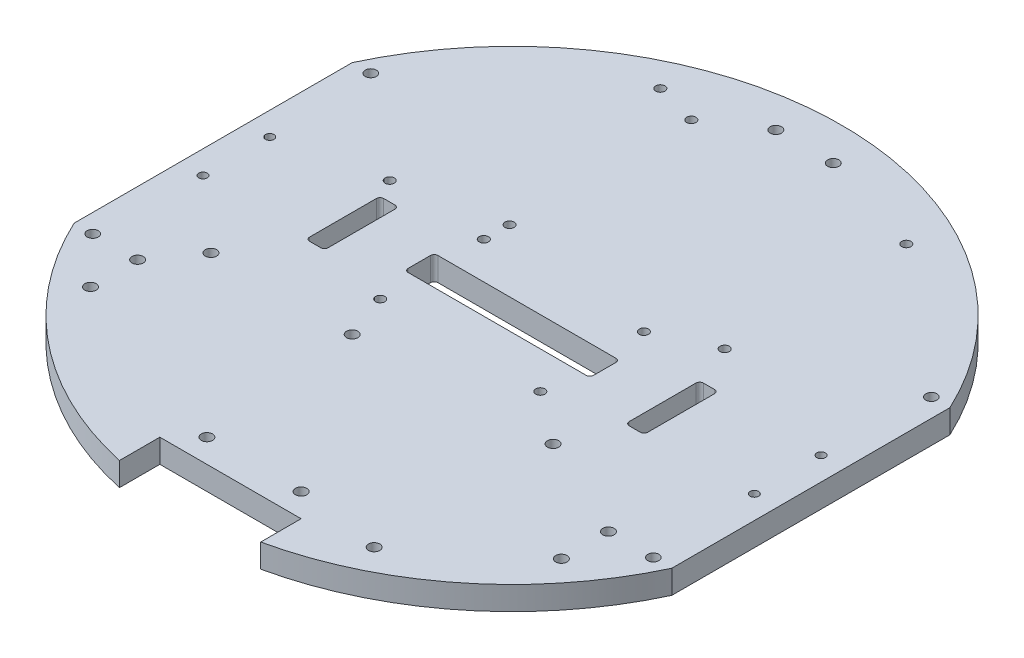
from build123d import *

# Parameters (mm, degrees)
MAIN_BODY_DEPTH             = 6.35
RASPBERRY_PI_REACH          = 122.169
SKETCH2_R                   = 1.25
MOTOR_MOUNTS_REACH          = 122.169
SKETCH3_R                   = 1.143
CASTER_REACH                = 122.169
SKETCH4_R                   = 1.524
SKETCH5_R                   = 1.524
GRABBER_MOUNT_DEPTH         = 121.168600308
SKETCH6_R                   = 1.524
FRONT_IR_DEPTH              = 121.168600308
SKETCH8_R                   = 1.524
SIDE_IR_DEPTH               = 121.168600308
SKETCH9_R                   = 1.524
PIXY_MOUNT_DEPTH            = 121.168600308
SKETCH10_W                  = 38.1
SKETCH10_H                  = 25.908
GRABBER_SLOT_DEPTH          = 121.168600308
SKETCH11_W                  = 5
SKETCH11_H                  = 20
SKETCH11_W_2                = 50
SKETCH11_H_2                = 8
WIRE_SLOTS_DEPTH            = 121.168600308
SKETCH13_R                  = 1.5
F_2ND_LEVEL_STANDOFFS_DEPTH = 121.168600308
FILLET1_R                   = 1
SKETCH14_R                  = 1.25
ENCODER_PERFBOARD_DEPTH     = 10
SKETCH15_R                  = 1.25
CUT_EXTRUDE2_DEPTH          = 10


with BuildPart() as part:
    # Sketch1 → Main Body (new body)
    with BuildSketch(Plane(origin=(0, 0, 0), x_dir=(1, 0, 0), z_dir=(0, 1, 0))):
        with BuildLine():
            Line((-80.603721998, 37.5), (-80.603721998, -37.5))
            ThreePointArc((-80.603721998, -37.5), (0, -88.9), (80.603721998, -37.5))
            Line((80.603721998, -37.5), (80.603721998, 37.5))
            ThreePointArc((80.603721998, 37.5), (0, 88.9), (-80.603721998, 37.5))
        make_face()
    extrude(amount=MAIN_BODY_DEPTH)

    # Sketch2 → Raspberry Pi (cut, up to next)
    with BuildSketch(Plane(origin=(0, 6.35, 0), x_dir=(1, 0, 0), z_dir=(0, 1, 0)), mode=Mode.PRIVATE) as raspberry_pi_sk1:
        with Locations((36.5, 69.85)):
            Circle(SKETCH2_R)
    raspberry_pi_tool1 = extrude(raspberry_pi_sk1.sketch, amount=-RASPBERRY_PI_REACH, mode=Mode.PRIVATE) & part.part
    # Sketch2 → Raspberry Pi (cut, up to next)
    with BuildSketch(Plane(origin=(0, 6.35, 0), x_dir=(1, 0, 0), z_dir=(0, 1, 0)), mode=Mode.PRIVATE) as raspberry_pi_sk2:
        with Locations((36.5, 20.85)):
            Circle(SKETCH2_R)
    raspberry_pi_tool2 = extrude(raspberry_pi_sk2.sketch, amount=-RASPBERRY_PI_REACH, mode=Mode.PRIVATE) & part.part
    # Sketch2 → Raspberry Pi (cut, up to next)
    with BuildSketch(Plane(origin=(0, 6.35, 0), x_dir=(1, 0, 0), z_dir=(0, 1, 0)), mode=Mode.PRIVATE) as raspberry_pi_sk3:
        with Locations((-21.5, 20.85)):
            Circle(SKETCH2_R)
    raspberry_pi_tool3 = extrude(raspberry_pi_sk3.sketch, amount=-RASPBERRY_PI_REACH, mode=Mode.PRIVATE) & part.part
    # Sketch2 → Raspberry Pi (cut, up to next)
    with BuildSketch(Plane(origin=(0, 6.35, 0), x_dir=(1, 0, 0), z_dir=(0, 1, 0)), mode=Mode.PRIVATE) as raspberry_pi_sk4:
        with Locations((-21.5, 69.85)):
            Circle(SKETCH2_R)
    raspberry_pi_tool4 = extrude(raspberry_pi_sk4.sketch, amount=-RASPBERRY_PI_REACH, mode=Mode.PRIVATE) & part.part
    add(raspberry_pi_tool1.solids().sort_by_distance((36.5, 6.35, -69.85))[0], mode=Mode.SUBTRACT)
    add(raspberry_pi_tool2.solids().sort_by_distance((36.5, 6.35, -20.85))[0], mode=Mode.SUBTRACT)
    add(raspberry_pi_tool3.solids().sort_by_distance((-21.5, 6.35, -20.85))[0], mode=Mode.SUBTRACT)
    add(raspberry_pi_tool4.solids().sort_by_distance((-21.5, 6.35, -69.85))[0], mode=Mode.SUBTRACT)

    # Sketch3 → Motor Mounts (cut, up to next)
    with BuildSketch(Plane(origin=(0, 6.35, 0), x_dir=(1, 0, 0), z_dir=(0, 1, 0)), mode=Mode.PRIVATE) as motor_mounts_sk1:
        with Locations((-74.353721998, 9)):
            Circle(SKETCH3_R)
    motor_mounts_tool1 = extrude(motor_mounts_sk1.sketch, amount=-MOTOR_MOUNTS_REACH, mode=Mode.PRIVATE) & part.part
    # Sketch3 → Motor Mounts (cut, up to next)
    with BuildSketch(Plane(origin=(0, 6.35, 0), x_dir=(1, 0, 0), z_dir=(0, 1, 0)), mode=Mode.PRIVATE) as motor_mounts_sk2:
        with Locations((-74.353721998, -9)):
            Circle(SKETCH3_R)
    motor_mounts_tool2 = extrude(motor_mounts_sk2.sketch, amount=-MOTOR_MOUNTS_REACH, mode=Mode.PRIVATE) & part.part
    # Sketch3 → Motor Mounts (cut, up to next)
    with BuildSketch(Plane(origin=(0, 6.35, 0), x_dir=(1, 0, 0), z_dir=(0, 1, 0)), mode=Mode.PRIVATE) as motor_mounts_sk3:
        with Locations((74.353721998, 9)):
            Circle(SKETCH3_R)
    motor_mounts_tool3 = extrude(motor_mounts_sk3.sketch, amount=-MOTOR_MOUNTS_REACH, mode=Mode.PRIVATE) & part.part
    # Sketch3 → Motor Mounts (cut, up to next)
    with BuildSketch(Plane(origin=(0, 6.35, 0), x_dir=(1, 0, 0), z_dir=(0, 1, 0)), mode=Mode.PRIVATE) as motor_mounts_sk4:
        with Locations((74.353721998, -9)):
            Circle(SKETCH3_R)
    motor_mounts_tool4 = extrude(motor_mounts_sk4.sketch, amount=-MOTOR_MOUNTS_REACH, mode=Mode.PRIVATE) & part.part
    add(motor_mounts_tool1.solids().sort_by_distance((-74.353722, 6.35, -9))[0], mode=Mode.SUBTRACT)
    add(motor_mounts_tool2.solids().sort_by_distance((-74.353722, 6.35, 9))[0], mode=Mode.SUBTRACT)
    add(motor_mounts_tool3.solids().sort_by_distance((74.353722, 6.35, -9))[0], mode=Mode.SUBTRACT)
    add(motor_mounts_tool4.solids().sort_by_distance((74.353722, 6.35, 9))[0], mode=Mode.SUBTRACT)

    # Sketch4 → Caster (cut, up to next)
    with BuildSketch(Plane(origin=(0, 6.35, 0), x_dir=(1, 0, 0), z_dir=(0, 1, 0)), mode=Mode.PRIVATE) as caster_sk1:
        with Locations((-7.747, 78.9)):
            Circle(SKETCH4_R)
    caster_tool1 = extrude(caster_sk1.sketch, amount=-CASTER_REACH, mode=Mode.PRIVATE) & part.part
    # Sketch4 → Caster (cut, up to next)
    with BuildSketch(Plane(origin=(0, 6.35, 0), x_dir=(1, 0, 0), z_dir=(0, 1, 0)), mode=Mode.PRIVATE) as caster_sk2:
        with Locations((7.747, 78.9)):
            Circle(SKETCH4_R)
    caster_tool2 = extrude(caster_sk2.sketch, amount=-CASTER_REACH, mode=Mode.PRIVATE) & part.part
    add(caster_tool1.solids().sort_by_distance((-7.747, 6.35, -78.9))[0], mode=Mode.SUBTRACT)
    add(caster_tool2.solids().sort_by_distance((7.747, 6.35, -78.9))[0], mode=Mode.SUBTRACT)

    # Sketch5 → Grabber Mount (cut, through all)
    with BuildSketch(Plane(origin=(0, 6.35, 0), x_dir=(1, 0, 0), z_dir=(0, 1, 0))):
        with Locations((35.56, -24.48608666)):
            Circle(SKETCH5_R)
        with Locations((35.56, -72.74608666)):
            Circle(SKETCH5_R)
    extrude(amount=-GRABBER_MOUNT_DEPTH, mode=Mode.SUBTRACT)

    # Sketch6 → Front IR (cut, through all)
    with BuildSketch(Plane(origin=(0, 6.35, 0), x_dir=(1, 0, 0), z_dir=(0, 1, 0))):
        with Locations((-12.7, -69.596)):
            Circle(SKETCH6_R)
        with Locations((12.7, -69.596)):
            Circle(SKETCH6_R)
    extrude(amount=-FRONT_IR_DEPTH, mode=Mode.SUBTRACT)

    # Sketch8 → Side IR (cut, through all)
    with BuildSketch(Plane(origin=(0, 6.35, 0), x_dir=(1, 0, 0), z_dir=(0, 1, 0))):
        with Locations((-63.5, -37.5)):
            Circle(SKETCH8_R)
        with Locations((-63.5, -50.2)):
            Circle(SKETCH8_R)
        with Locations((63.5, -50.2)):
            Circle(SKETCH8_R)
        with Locations((63.5, -37.5)):
            Circle(SKETCH8_R)
    extrude(amount=-SIDE_IR_DEPTH, mode=Mode.SUBTRACT)

    # Sketch9 → Pixy Mount (cut, through all)
    with BuildSketch(Plane(origin=(0, 6.35, 0), x_dir=(1, 0, 0), z_dir=(0, 1, 0))):
        with Locations((-55.203721998, -26.01008666)):
            Circle(SKETCH9_R)
        with Locations((-17.103721998, -26.01008666)):
            Circle(SKETCH9_R)
    extrude(amount=-PIXY_MOUNT_DEPTH, mode=Mode.SUBTRACT)

    # Sketch10 → Grabber slot (cut, through all)
    with BuildSketch(Plane(origin=(0, 6.35, 0), x_dir=(1, 0, 0), z_dir=(0, 1, 0))):
        with Locations((0, -88.9)):
            Rectangle(SKETCH10_W, SKETCH10_H)
    extrude(amount=-GRABBER_SLOT_DEPTH, mode=Mode.SUBTRACT)

    # Sketch11 → Wire slots (cut, through all)
    with BuildSketch(Plane(origin=(0, 6.35, 0), x_dir=(1, 0, 0), z_dir=(0, 1, 0))):
        with Locations((-43.103721998, 0)):
            Rectangle(SKETCH11_W, SKETCH11_H)
        Rectangle(SKETCH11_W_2, SKETCH11_H_2)
        with Locations((43.103721998, 0)):
            Rectangle(SKETCH11_W, SKETCH11_H)
    extrude(amount=-WIRE_SLOTS_DEPTH, mode=Mode.SUBTRACT)

    # Sketch13 → 2nd level standoffs (cut, through all)
    with BuildSketch(Plane(origin=(0, 6.35, 0), x_dir=(1, 0, 0), z_dir=(0, 1, 0))):
        with Locations((75.603721998, -37.5)):
            Circle(SKETCH13_R)
        with Locations((-75.603721998, -37.5)):
            Circle(SKETCH13_R)
        with Locations((75.603721998, 37.5)):
            Circle(SKETCH13_R)
        with Locations((-75.603721998, 37.5)):
            Circle(SKETCH13_R)
    extrude(amount=-F_2ND_LEVEL_STANDOFFS_DEPTH, mode=Mode.SUBTRACT)

    # Fillet1
    fillet1_edges = [part.edges().sort_by_distance(p)[0] for p in [
        (40.603721998, 3.175, -10),
        (40.603721998, 3.175, 10),
        (45.603721998, 3.175, 10),
        (45.603721998, 3.175, -10),
        (-45.603721998, 3.175, 10),
        (-40.603721998, 3.175, 10),
        (-45.603721998, 3.175, -10),
        (-40.603721998, 3.175, -10),
        (-25, 3.175, 4),
        (-25, 3.175, -4),
        (25, 3.175, 4),
        (25, 3.175, -4),
    ]]
    fillet(fillet1_edges, radius=FILLET1_R)

    # Sketch14 → Encoder Perfboard (cut)
    with BuildSketch(Plane(origin=(0, 6.35, 0), x_dir=(1, 0, 0), z_dir=(0, 1, 0))):
        with Locations((-21.59, 13.97)):
            Circle(SKETCH14_R)
        with Locations((21.59, 13.97)):
            Circle(SKETCH14_R)
        with Locations((21.59, -13.97)):
            Circle(SKETCH14_R)
        with Locations((-21.59, -13.97)):
            Circle(SKETCH14_R)
    extrude(amount=-ENCODER_PERFBOARD_DEPTH, mode=Mode.SUBTRACT)

    # Sketch15 → Cut-Extrude2 (cut)
    with BuildSketch(Plane(origin=(0, 6.35, 0), x_dir=(1, 0, 0), z_dir=(0, 1, 0))):
        with Locations((-48, 15)):
            Circle(SKETCH15_R)
        with Locations((-33, 73)):
            Circle(SKETCH15_R)
    extrude(amount=-CUT_EXTRUDE2_DEPTH, mode=Mode.SUBTRACT)


solid = part.part
